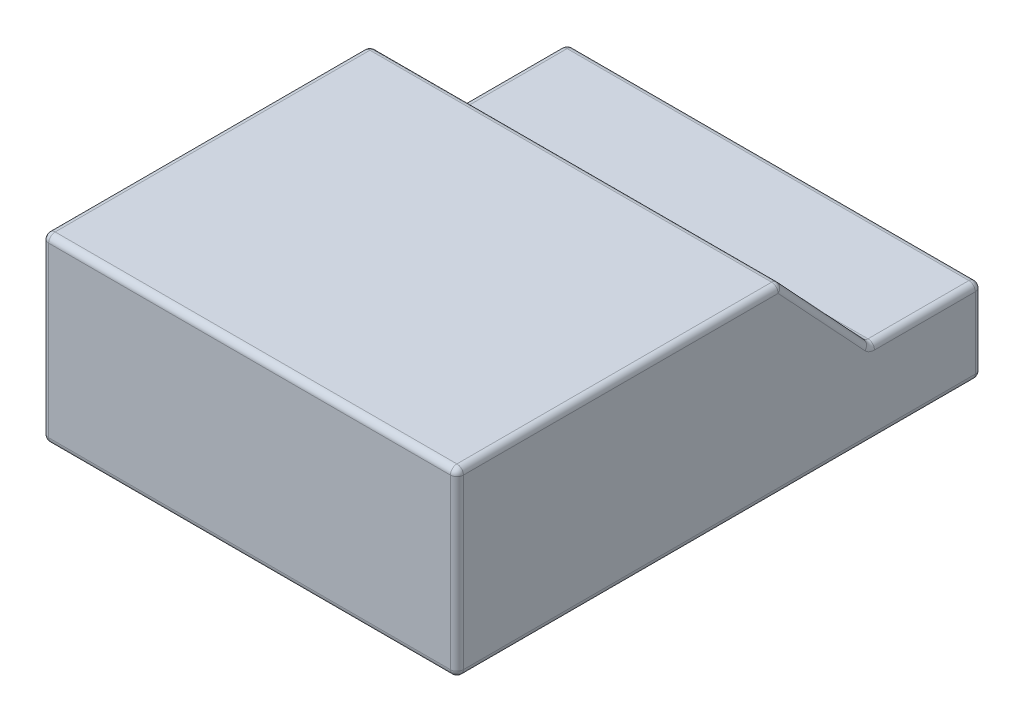
from build123d import *

# Parameters (mm, degrees)
BOSS_EXTRUDE1_DEPTH = 17
SKETCH2_W           = 60
SKETCH2_H           = 11
BOSS_EXTRUDE2_DEPTH = 1
BOSS_EXTRUDE3_DEPTH = 64
CUT_EXTRUDE1_DEPTH  = 60
FILLET1_R           = 1


with BuildPart() as part:
    # Sketch1 → Boss-Extrude1 (new body)
    with BuildSketch(Plane.XY):
        Polygon((0, 0), (0, 11), (60, 11), (60, 0), (62, 0), (62, 13), (-2, 13), (-2, 0), align=None)
    extrude(amount=BOSS_EXTRUDE1_DEPTH)

    # Sketch2 → Boss-Extrude2 (add)
    with BuildSketch(Plane(origin=(0, 0, 0), x_dir=(-1, 0, 0), z_dir=(0, 0, -1))):
        with Locations((-30, 5.5)):
            Rectangle(SKETCH2_W, SKETCH2_H)
    extrude(amount=-BOSS_EXTRUDE2_DEPTH)

    # Sketch4 → Boss-Extrude3 (add)
    with BuildSketch(Plane.ZY.offset(2)):
        Polygon((17, 13), (31, 28), (81, 28), (81, 0), (17, 0), align=None)
    extrude(amount=-BOSS_EXTRUDE3_DEPTH)

    # Sketch6 → Cut-Extrude1 (cut)
    with BuildSketch(Plane.ZY):
        Polygon((19, 0), (19, 12.211673639), (31.869104604, 26), (79, 26), (79, 0), align=None)
    extrude(amount=-CUT_EXTRUDE1_DEPTH, mode=Mode.SUBTRACT)

    # Fillet1
    fillet1_edges = [part.edges().sort_by_distance(p)[0] for p in [
        (-2, 0, 40.5),
        (-2, 13, 8.5),
        (62, 13, 8.5),
        (62, 0, 40.5),
        (30, 11, 1),
        (30, 13, 17),
        (62, 20.5, 24),
        (62, 28, 56),
        (30, 28, 31),
        (62, 14, 81),
        (30, 28, 81),
        (30, 0, 81),
        (-2, 14, 81),
        (-2, 28, 56),
        (-2, 20.5, 24),
        (-2, 6.5, 0),
        (30, 13, 0),
        (62, 6.5, 0),
        (30, 0, 0),
    ]]
    fillet(fillet1_edges, radius=FILLET1_R - 0.0001)  # a hair under: the kernel refuses the full size


solid = part.part
